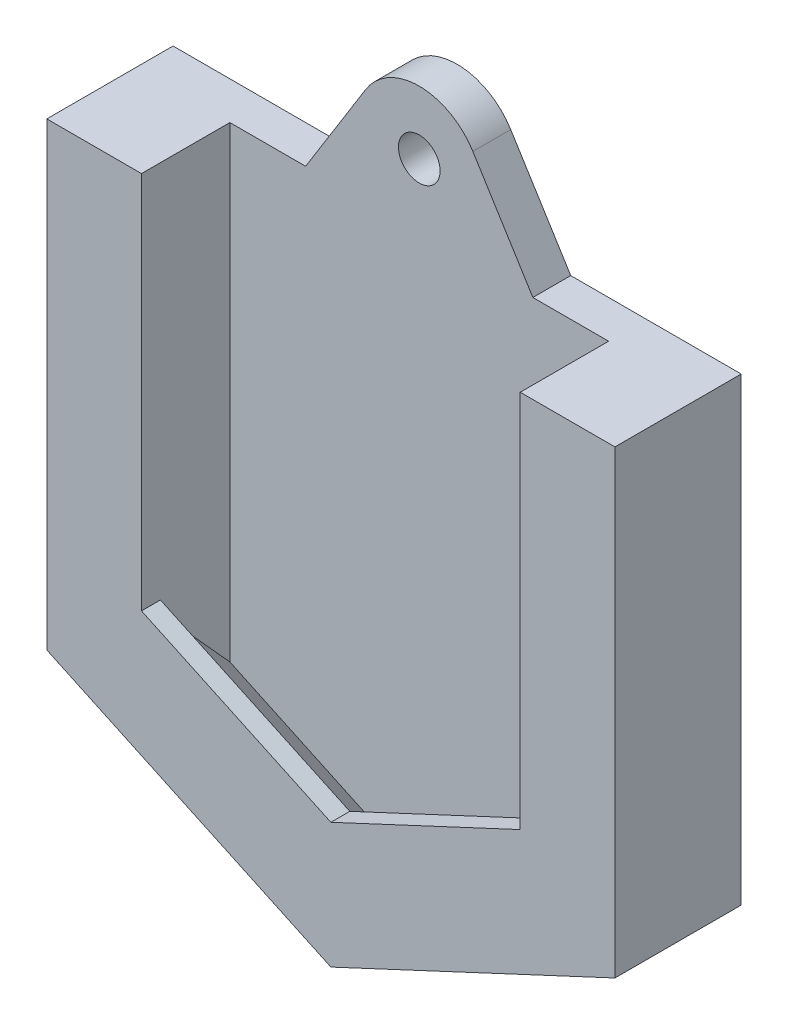
from build123d import *

# Parameters (mm, degrees)
ESBO_O1_W                = 45
ESBO_O1_H                = 50
RESSALTO_EXTRUS_O1_DEPTH = 10
CORTE_EXTRUS_O1_DEPTH    = 7
CORTE_EXTRUS_O2_DEPTH    = 5.5
CHANFRO1_SIZE            = 5.5
ESBO_O4_R                = 1.65
RESSALTO_EXTRUS_O2_DEPTH = 3
CORTE_EXTRUS_O3_DEPTH    = 43.793106922


with BuildPart() as part:
    # Esboço1 → Ressalto-extrusão1 (new body)
    with BuildSketch(Plane.XY):
        Rectangle(ESBO_O1_W, ESBO_O1_H)
    extrude(amount=RESSALTO_EXTRUS_O1_DEPTH)

    # Esboço2 → Corte-extrusão1 (cut)
    with BuildSketch(Plane.XY.offset(10)):
        Polygon((-15, -5), (0, -12), (15, -5), (15, 25), (-15, 25), align=None)
    extrude(amount=-CORTE_EXTRUS_O1_DEPTH, mode=Mode.SUBTRACT)

    # Esboço3 → Corte-extrusão2 (cut)
    with BuildSketch(Plane.XY.offset(3)):
        Polygon((-15, -5), (-15, -12), (0, -19), (15, -12), (15, -5), align=None)
    extrude(amount=CORTE_EXTRUS_O2_DEPTH, mode=Mode.SUBTRACT)

    # Chanfro1
    chanfro1_edges = [part.edges().sort_by_distance(p)[0] for p in [
        (-7.5, -15.5, 8.5),
        (7.5, -15.5, 8.5),
    ]]
    chamfer(chanfro1_edges, length=CHANFRO1_SIZE - 0.0001)  # a hair under: the kernel refuses the full size

    # Esboço4 → Ressalto-extrusão2 (add)
    with BuildSketch(Plane(origin=(0, 0, 0), x_dir=(-1, 0, 0), z_dir=(0, 0, -1))):
        with BuildLine():
            Line((4.245283019, 32.641509434), (9, 25))
            Line((9, 25), (-9, 25))
            Line((-9, 25), (-4.245283019, 32.641509434))
            ThreePointArc((-4.245283019, 32.641509434), (0, 35), (4.245283019, 32.641509434))
        make_face()
        with Locations((0, 30)):
            Circle(ESBO_O4_R, mode=Mode.SUBTRACT)
    extrude(amount=-RESSALTO_EXTRUS_O2_DEPTH)

    # Esboço5 → Corte-extrusão3 (cut, through all)
    with BuildSketch(Plane.XY.offset(10)):
        Polygon((-22.5, -11.431767214), (0, -21.931767214), (22.5, -11.431767214), (22.5, -32.501990612), (-22.5, -32.501990612), align=None)
    extrude(amount=-CORTE_EXTRUS_O3_DEPTH, mode=Mode.SUBTRACT)


solid = part.part
